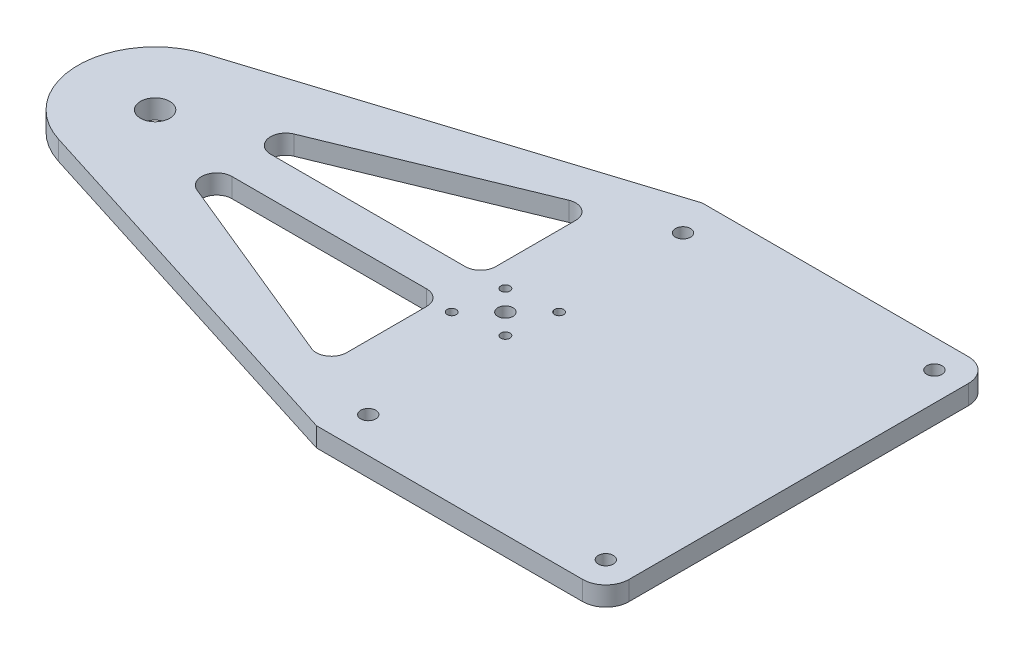
from build123d import *

# Parameters (mm, degrees)
SKETCH1_W           = 95.25
SKETCH1_H           = 127
BOSS_EXTRUDE1_DEPTH = 6.35
BOSS_EXTRUDE3_DEPTH = 6.35
SKETCH5_R           = 4.826
SKETCH5_R_2         = 2.5
SKETCH5_R_3         = 1.5
CUT_EXTRUDE1_DEPTH  = 201.11039673
CUT_EXTRUDE2_DEPTH  = 201.11039673
FILLET9_R           = 5
FILLET10_R          = 7.62
SKETCH7_R           = 2.4892
CUT_EXTRUDE3_DEPTH  = 201.11039673


with BuildPart() as part:
    # Sketch1 → Boss-Extrude1 (new body)
    with BuildSketch(Plane(origin=(0, 0, 0), x_dir=(1, 0, 0), z_dir=(0, 1, 0))):
        Rectangle(SKETCH1_W, SKETCH1_H)
    extrude(amount=BOSS_EXTRUDE1_DEPTH)

    # Sketch4 → Boss-Extrude3 (add)
    with BuildSketch(Plane(origin=(0, 6.35, 0), x_dir=(1, 0, 0), z_dir=(0, 1, 0))):
        with BuildLine():
            Line((-47.625, 63.5), (-171.916018217, 24.219268021))
            ThreePointArc((-171.916018217, 24.219268021), (-189.6618, 0), (-171.916018217, -24.219268021))
            Line((-171.916018217, -24.219268021), (-47.625, -63.5))
            Line((-47.625, -63.5), (-47.625, 63.5))
        make_face()
    extrude(amount=-BOSS_EXTRUDE3_DEPTH)

    # Sketch5 → Cut-Extrude1 (cut, through all)
    with BuildSketch(Plane(origin=(0, 6.35, 0), x_dir=(1, 0, 0), z_dir=(0, 1, 0))):
        with Locations((-164.2618, 0)):
            Circle(SKETCH5_R)
        with Locations((-48.9458, 0)):
            Circle(SKETCH5_R_2)
        with Locations((-42.228285579, -6.717514421)):
            Circle(SKETCH5_R_3)
        with Locations((-40.106965235, 8.838834765)):
            Circle(SKETCH5_R_3)
        with Locations((-57.784634765, -8.838834765)):
            Circle(SKETCH5_R_3)
        with Locations((-55.663314421, 6.717514421)):
            Circle(SKETCH5_R_3)
    extrude(amount=-CUT_EXTRUDE1_DEPTH, mode=Mode.SUBTRACT)

    # Sketch6 → Cut-Extrude2 (cut, through all)
    with BuildSketch(Plane(origin=(0, 6.35, 0), x_dir=(1, 0, 0), z_dir=(0, 1, 0))):
        Polygon((-63.5, 45.163743355), (-157.9118, 6.35), (-63.5, 6.35), align=None)
        Polygon((-63.5, -6.35), (-63.5, -45.163743355), (-157.9118, -6.35), align=None)
    extrude(amount=-CUT_EXTRUDE2_DEPTH, mode=Mode.SUBTRACT)

    # Fillet9
    fillet9_edges = [part.edges().sort_by_distance(p)[0] for p in [
        (-157.9118, 3.175, 6.35),
        (-63.5, 3.175, 6.35),
        (-63.5, 3.175, 45.163743355),
        (-63.5, 3.175, -6.35),
        (-157.9118, 3.175, -6.35),
        (-63.5, 3.175, -45.163743355),
    ]]
    fillet(fillet9_edges, radius=FILLET9_R)

    # Fillet10
    fillet10_edges = [part.edges().sort_by_distance(p)[0] for p in [
        (47.625, 3.175, -63.5),
        (47.625, 3.175, 63.5),
    ]]
    fillet(fillet10_edges, radius=FILLET10_R)

    # Sketch7 → Cut-Extrude3 (cut, through all)
    with BuildSketch(Plane(origin=(0, 6.35, 0), x_dir=(1, 0, 0), z_dir=(0, 1, 0))):
        with Locations((-42.286053483, -51.811053483)):
            Circle(SKETCH7_R)
        with Locations((-42.286053483, 51.811053483)):
            Circle(SKETCH7_R)
        with Locations((38.202339924, 54.077339924)):
            Circle(SKETCH7_R)
        with Locations((38.202339924, -54.077339924)):
            Circle(SKETCH7_R)
    extrude(amount=-CUT_EXTRUDE3_DEPTH, mode=Mode.SUBTRACT)


solid = part.part
